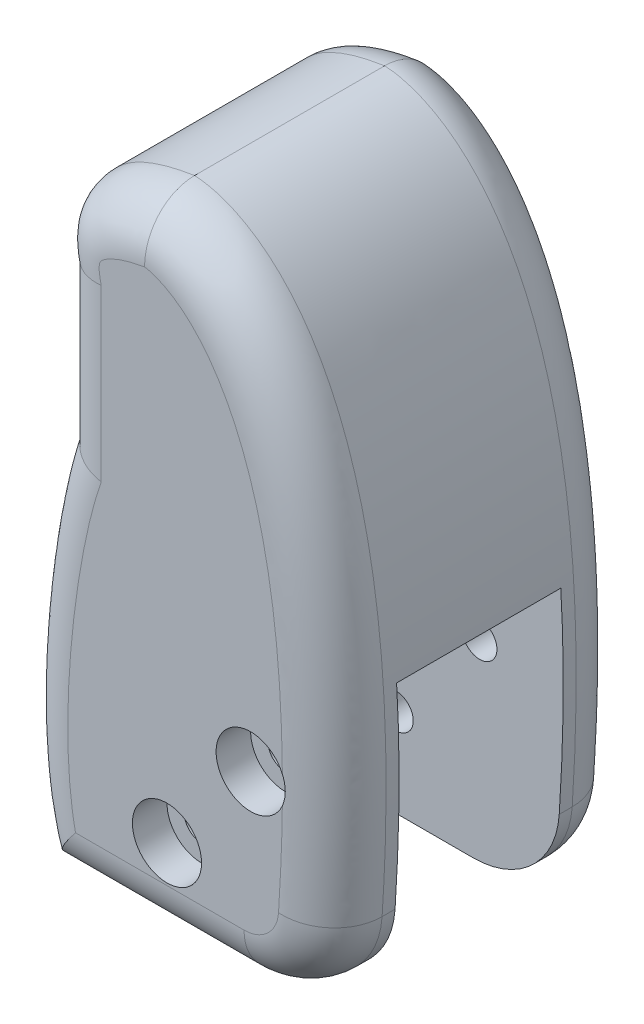
from build123d import *

# Parameters (mm, degrees)
SKETCH1_R               = 1
BOSS_EXTRUDE1_DEPTH     = 8.5
CUT_EXTRUDE1_DEPTH      = 4.75
CUT_EXTRUDE2_DEPTH      = 27
CUT_EXTRUDE2_DEPTH_BACK = 27
SKETCH3_R               = 1
FILLET2_R               = 5
FILLET3_R               = 3
SKETCH4_R               = 2
CUT_EXTRUDE3_DEPTH      = 2
CUT_EXTRUDE5_DEPTH      = 2


with BuildPart() as part:
    # Sketch1 → Boss-Extrude1 (new, symmetric)
    with BuildSketch(Plane.XY):
        with BuildLine():
            Line((16.508667877, -2.595475524), (0, -2.595475524))
            add(Edge.make_bspline(
                [(0.653134662, 19.216429462), (-1.073795894, 13.971034752), (-2.343604383, 2.378563984), (0, -2.595475524)],
                knots=[0, 0, 0, 0, 1, 1, 1, 1], degree=3))
            Line((0.653134662, 19.216429462), (0.653134662, 28.276166515))
            add(Edge.make_bspline(
                [(6.054591798, 33.78588054), (-0.278146256, 32.829095448), (0.653134662, 28.276166515)],
                knots=[0, 0, 0, 1, 1, 1], degree=2))
            add(Edge.make_bspline(
                [(6.054591798, 33.78588054), (9.407427246, 33.66170145), (19.780172911, 29.153716218), (16.508667877, -2.595475524)],
                knots=[0, 0, 0, 0, 1, 1, 1, 1], degree=3))
        make_face()
        with Locations((7.458004126, 2.538770749)):
            Circle(SKETCH1_R, mode=Mode.SUBTRACT)
    extrude(amount=BOSS_EXTRUDE1_DEPTH, both=True)

    # Sketch2 → Cut-Extrude1 (cut, symmetric)
    with BuildSketch(Plane.XY):
        with BuildLine():
            Line((-2.734436758, 4.92445999), (-2.734436758, -3.150518317))
            Line((-2.734436758, -3.150518317), (19.73217979, -3.150518317))
            Line((19.73217979, -3.150518317), (19.73217979, 11.959772459))
            add(Edge.make_bspline(
                [(-2.734436758, 4.92445999), (11.160893183, 18.369579996), (19.73217979, 11.959772459)],
                knots=[0, 0, 0, 1, 1, 1], degree=2))
        make_face()
    extrude(amount=CUT_EXTRUDE1_DEPTH, both=True, mode=Mode.SUBTRACT)

    # Sketch3 → Cut-Extrude2 (cut, two sides: drawn at the far end of the back side and taken through both)
    with BuildSketch(Plane.XY.offset(-CUT_EXTRUDE2_DEPTH_BACK)):
        with Locations(Location((12.299736138, 8.538138159, 0), (0, 0, 180))):
            Circle(SKETCH3_R)
    extrude(amount=CUT_EXTRUDE2_DEPTH + CUT_EXTRUDE2_DEPTH_BACK, mode=Mode.SUBTRACT)

    # Fillet2
    fillet2_edges = [part.edges().sort_by_distance(p)[0] for p in [
        (16.508667877, -2.595475524, 6.625),
        (16.508667877, -2.595475524, -6.625),
    ]]
    fillet(fillet2_edges, radius=FILLET2_R)

    # Fillet3
    fillet3_edges = [part.edges().sort_by_distance(p)[0] for p in [
        (1.537858487, 31.930059488, 8.5),
        (0.653134662, 23.746297988, 8.5),
        (-1.199883271, 8.208718768, 8.5),
        (13.359432957, 28.20945218, -8.5),
        (0.653134662, 23.746297988, -8.5),
        (13.359432957, 28.20945218, 8.5),
        (15.334207636, -1.246289719, 8.5),
        (1.537858487, 31.930059488, -8.5),
        (15.334207636, -1.246289719, -8.5),
        (5.958920886, -2.595475524, -8.5),
        (-1.199883271, 8.208718768, -8.5),
        (5.958920886, -2.595475524, 8.5),
    ]]
    fillet(fillet3_edges, radius=FILLET3_R - 0.0004)  # a hair under: the kernel refuses the full size

    # Sketch4 → Cut-Extrude3 (cut)
    with BuildSketch(Plane.XY.offset(8.5)):
        with Locations((12.299736138, 8.538138159)):
            Circle(SKETCH4_R)
        with Locations((7.458004126, 2.538770749)):
            Circle(SKETCH4_R)
    extrude(amount=-CUT_EXTRUDE3_DEPTH, mode=Mode.SUBTRACT)

    # Sketch6 → Cut-Extrude5 (cut)
    with BuildSketch(Plane(origin=(0, 0, -8.5), x_dir=(-1, 0, 0), z_dir=(0, 0, -1))):
        Polygon((-12.62304761, 6.193185489), (-10.430603291, 7.085665876), (-10.107291819, 9.430618546), (-11.976424666, 10.88309083), (-14.168868985, 9.990610442), (-14.492180457, 7.645657772), align=None)
        Polygon((-7.781315598, 0.193818079), (-5.588871279, 1.086298466), (-5.265559807, 3.431251136), (-7.134692654, 4.883723419), (-9.327136973, 3.991243032), (-9.650448445, 1.646290362), align=None)
    extrude(amount=-CUT_EXTRUDE5_DEPTH, mode=Mode.SUBTRACT)


solid = part.part
